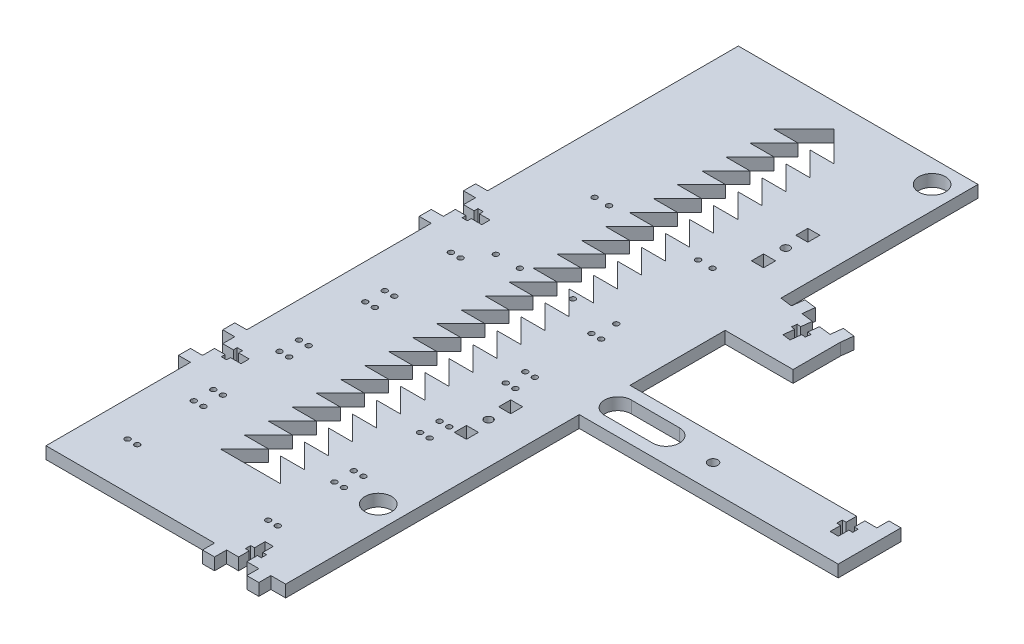
from build123d import *

# Parameters (mm, degrees)
AXLE_SUPPORT_PLATE_R   = 7.030128061
AXLE_SUPPORT_PLATE_W   = 6.35
AXLE_SUPPORT_PLATE_H   = 6.35
AXLE_SUPPORT_PLATE_R_2 = 2.159
AXLE_SUPPORT_PLATE_R_3 = 2.54
BOSS_EXTRUDE1_DEPTH    = 6.35
BOSS_EXTRUDE2_DEPTH    = 6.35
SKETCH2_R              = 1.397
CUT_EXTRUDE1_DEPTH     = 6.35


with BuildPart() as part:
    # Axle Support Plate → Boss-Extrude1 (new body)
    with BuildSketch(Plane(origin=(0, 0, 0), x_dir=(1, 0, 0), z_dir=(0, 1, 0))):
        Polygon((55.41293597, -182.58506403), (63.20506403, -182.58506403), (63.20506403, -102.239078956), (63.20506403, -27.735320151), (199.775192091, -27.735320151), (199.775192091, -0.97506403), (199.775192091, 5.37493597), (193.425192091, 5.37493597), (193.425192091, -0.97506403), (187.075192091, -0.97506403), (187.075192091, -6.510064009), (189.116192073, -6.510064009), (189.116192073, -9.410064051), (187.075192091, -9.410064051), (187.075192091, -14.94506403), (182.757192091, -14.94506403), (182.757192091, -9.410064051), (180.716192109, -9.410064051), (180.716192109, -6.510064009), (182.757192091, -6.510064009), (182.757192091, -0.97506403), (63.20506403, -0.97506403), (63.20506403, 182.58506403), (-63.20506403, 182.58506403), (-63.20506403, 50.33293597), (-69.55506403, 50.33293597), (-69.55506403, 43.98293597), (-63.20506403, 43.98293597), (-63.20506403, 37.63293597), (-57.61706403, 37.63293597), (-57.61706403, 39.673935952), (-54.82306403, 39.673935952), (-54.82306403, 37.63293597), (-49.23506403, 37.63293597), (-49.23506403, 33.31493597), (-54.82306403, 33.31493597), (-54.82306403, 31.273935988), (-57.61706403, 31.273935988), (-57.61706403, 33.31493597), (-63.20506403, 33.31493597), (-63.20506403, 26.96493597), (-69.55506403, 26.96493597), (-69.55506403, 20.61493597), (-63.20506403, 20.61493597), (-63.20506403, -76.66706403), (-69.55506403, -76.66706403), (-69.55506403, -83.01706403), (-63.20506403, -83.01706403), (-63.20506403, -89.36706403), (-57.61706403, -89.36706403), (-57.61706403, -87.326064048), (-54.82306403, -87.326064048), (-54.82306403, -89.36706403), (-49.23506403, -89.36706403), (-49.23506403, -93.68506403), (-54.82306403, -93.68506403), (-54.82306403, -95.726064012), (-57.61706403, -95.726064012), (-57.61706403, -93.68506403), (-63.20506403, -93.68506403), (-63.20506403, -100.03506403), (-69.55506403, -100.03506403), (-69.55506403, -106.38506403), (-63.20506403, -106.38506403), (-63.20506403, -182.58506403), (25.69493597, -182.58506403), (25.69493597, -188.93506403), (32.04493597, -188.93506403), (32.04493597, -182.58506403), (38.39493597, -182.58506403), (38.39493597, -176.99706403), (36.353935988, -176.99706403), (36.353935988, -174.20306403), (38.39493597, -174.20306403), (38.39493597, -168.61506403), (42.71293597, -168.61506403), (42.71293597, -174.20306403), (44.753935952, -174.20306403), (44.753935952, -176.99706403), (42.71293597, -176.99706403), (42.71293597, -182.58506403), (49.06293597, -182.58506403), (49.06293597, -188.93506403), (55.41293597, -188.93506403), align=None)
        with Locations((51.09493597, -121.62506403)):
            Circle(AXLE_SUPPORT_PLATE_R, mode=Mode.SUBTRACT)
        with Locations((41.56993597, -65.61806403)):
            Rectangle(AXLE_SUPPORT_PLATE_W, AXLE_SUPPORT_PLATE_H, mode=Mode.SUBTRACT)
        with Locations((41.56993597, -53.93406403)):
            Circle(AXLE_SUPPORT_PLATE_R_2, mode=Mode.SUBTRACT)
        with Locations((41.56993597, -42.25006403)):
            Rectangle(AXLE_SUPPORT_PLATE_W, AXLE_SUPPORT_PLATE_H, mode=Mode.SUBTRACT)
        with BuildLine():
            ThreePointArc((70.235192091, -21.385320151), (63.20506403, -14.355192091), (70.235192091, -7.32506403))
            Line((70.235192091, -7.32506403), (95.635192091, -7.32506403))
            ThreePointArc((95.635192091, -7.32506403), (102.665320151, -14.355192091), (95.635192091, -21.385320151))
            Line((95.635192091, -21.385320151), (70.235192091, -21.385320151))
        make_face(mode=Mode.SUBTRACT)
        with Locations((120.400192091, -14.355192091)):
            Circle(AXLE_SUPPORT_PLATE_R_3, mode=Mode.SUBTRACT)
        Polygon((-15.875, 154.01006403), (0, 169.88506403), (15.875, 154.01006403), (3.175, 154.01006403), (15.875, 141.31006403), (3.175, 141.31006403), (15.875, 128.61006403), (3.175, 128.61006403), (15.875, 115.91006403), (3.175, 115.91006403), (15.875, 103.21006403), (3.175, 103.21006403), (15.875, 90.51006403), (3.175, 90.51006403), (15.875, 77.81006403), (3.175, 77.81006403), (15.875, 65.11006403), (3.175, 65.11006403), (15.875, 52.41006403), (3.175, 52.41006403), (15.875, 39.71006403), (3.175, 39.71006403), (15.875, 27.01006403), (3.175, 27.01006403), (15.875, 14.31006403), (3.175, 14.31006403), (15.875, 1.61006403), (3.175, 1.61006403), (15.875, -11.08993597), (3.175, -11.08993597), (15.875, -23.78993597), (3.175, -23.78993597), (15.875, -36.48993597), (3.175, -36.48993597), (15.875, -49.18993597), (3.175, -49.18993597), (15.875, -61.88993597), (3.175, -61.88993597), (15.875, -74.58993597), (3.175, -74.58993597), (15.875, -87.28993597), (3.175, -87.28993597), (15.875, -99.98993597), (3.175, -99.98993597), (15.875, -112.68993597), (3.175, -112.68993597), (15.875, -125.38993597), (3.175, -125.38993597), (15.875, -138.08993597), (-15.875, -138.08993597), (-3.175, -125.38993597), (-15.875, -125.38993597), (-3.175, -112.68993597), (-15.875, -112.68993597), (-3.175, -99.98993597), (-15.875, -99.98993597), (-3.175, -87.28993597), (-15.875, -87.28993597), (-3.175, -74.58993597), (-15.875, -74.58993597), (-3.175, -61.88993597), (-15.875, -61.88993597), (-3.175, -49.18993597), (-15.875, -49.18993597), (-3.175, -36.48993597), (-15.875, -36.48993597), (-3.175, -23.78993597), (-15.875, -23.78993597), (-3.175, -11.08993597), (-15.875, -11.08993597), (-3.175, 1.61006403), (-15.875, 1.61006403), (-7.727151853, 9.757912177), (-6.50875, 10.97631403), (-3.175, 14.31006403), (-15.875, 14.31006403), (-3.175, 27.01006403), (-15.875, 27.01006403), (-3.175, 39.71006403), (-15.875, 39.71006403), (-3.175, 52.41006403), (-15.875, 52.41006403), (-3.175, 65.11006403), (-15.875, 65.11006403), (-3.175, 77.81006403), (-15.875, 77.81006403), (-3.175, 90.51006403), (-15.875, 90.51006403), (-3.175, 103.21006403), (-15.875, 103.21006403), (-3.175, 115.91006403), (-15.875, 115.91006403), (-3.175, 128.61006403), (-15.875, 128.61006403), (-3.175, 141.31006403), (-15.875, 141.31006403), (-3.175, 154.01006403), align=None, mode=Mode.SUBTRACT)
        with Locations((41.56993597, 91.09993597)):
            Rectangle(AXLE_SUPPORT_PLATE_W, AXLE_SUPPORT_PLATE_H, mode=Mode.SUBTRACT)
        with Locations((41.56993597, 102.78393597)):
            Circle(AXLE_SUPPORT_PLATE_R_2, mode=Mode.SUBTRACT)
        with Locations((41.56993597, 114.46793597)):
            Rectangle(AXLE_SUPPORT_PLATE_W, AXLE_SUPPORT_PLATE_H, mode=Mode.SUBTRACT)
        with Locations((51.09493597, 170.47493597)):
            Circle(AXLE_SUPPORT_PLATE_R, mode=Mode.SUBTRACT)
    extrude(amount=BOSS_EXTRUDE1_DEPTH)

    # Sketch1 → Boss-Extrude2 (add)
    with BuildSketch(Plane(origin=(0, 6.35, 0), x_dir=(1, 0, 0), z_dir=(0, 1, 0))):
        Polygon((99.004218628, 49.239073995), (99.004218628, 74.257203072), (99.778088958, 80.559871135), (93.475420895, 81.333741465), (92.701550565, 75.031073402), (86.398882502, 75.804943733), (85.717876611, 70.258595838), (87.743663289, 70.00986051), (87.403160343, 67.236686562), (85.377373665, 67.48542189), (84.696367774, 61.939073995), (80.410553492, 62.465305819), (81.091559383, 68.011653715), (79.065772705, 68.260389042), (79.40627565, 71.03356299), (81.432062328, 70.784827662), (82.113068219, 76.331175558), (75.810400156, 77.105045888), (76.584270487, 83.407713951), (70.281602424, 84.181584282), (69.507732093, 77.878916219), (63.20506403, 78.65278655), (63.20506403, 49.239073995), align=None)
    extrude(amount=-BOSS_EXTRUDE2_DEPTH)

    # Sketch2 → Cut-Extrude1 (cut)
    with BuildSketch(Plane(origin=(0, 6.35, 0), x_dir=(1, 0, 0), z_dir=(0, 1, 0))):
        with Locations((8.655592356, 23.463861108)):
            Circle(SKETCH2_R)
        with Locations((-19.284407644, 23.463861108)):
            Circle(SKETCH2_R)
        with Locations((23.895592356, 74.263861108)):
            Circle(SKETCH2_R)
        with Locations((-24.364407644, 75.533861108)):
            Circle(SKETCH2_R)
        with Locations((-31.984407644, 75.533861108)):
            Circle(SKETCH2_R)
        with Locations((31.515592356, 74.263861108)):
            Circle(SKETCH2_R)
        with Locations((-31.984407644, 23.463861108)):
            Circle(SKETCH2_R)
        with Locations((31.515592356, 23.463861108)):
            Circle(SKETCH2_R)
        with Locations((-39.658320907, -123.108510942)):
            Circle(SKETCH2_R)
        with Locations((34.477929093, -123.108510942)):
            Circle(SKETCH2_R)
        with Locations((29.397929093, -123.108510942)):
            Circle(SKETCH2_R)
        with Locations((-44.738320907, -158.033510942)):
            Circle(SKETCH2_R)
        with Locations((-44.738320907, -123.108510942)):
            Circle(SKETCH2_R)
        with Locations((29.397929093, -158.033510942)):
            Circle(SKETCH2_R)
        with Locations((-39.658320907, -158.033510942)):
            Circle(SKETCH2_R)
        with Locations((34.477929093, -158.033510942)):
            Circle(SKETCH2_R)
        with Locations((-39.658320907, -77.902676515)):
            Circle(SKETCH2_R)
        with Locations((34.477929093, -77.902676515)):
            Circle(SKETCH2_R)
        with Locations((29.397929093, -77.902676515)):
            Circle(SKETCH2_R)
        with Locations((-44.738320907, -112.827676515)):
            Circle(SKETCH2_R)
        with Locations((-44.738320907, -77.902676515)):
            Circle(SKETCH2_R)
        with Locations((29.397929093, -112.827676515)):
            Circle(SKETCH2_R)
        with Locations((-39.658320907, -112.827676515)):
            Circle(SKETCH2_R)
        with Locations((34.477929093, -112.827676515)):
            Circle(SKETCH2_R)
        with Locations((-39.658320907, -32.696842088)):
            Circle(SKETCH2_R)
        with Locations((34.477929093, -32.696842088)):
            Circle(SKETCH2_R)
        with Locations((29.397929093, -32.696842088)):
            Circle(SKETCH2_R)
        with Locations((-44.738320907, -67.621842088)):
            Circle(SKETCH2_R)
        with Locations((-44.738320907, -32.696842088)):
            Circle(SKETCH2_R)
        with Locations((29.397929093, -67.621842088)):
            Circle(SKETCH2_R)
        with Locations((-39.658320907, -67.621842088)):
            Circle(SKETCH2_R)
        with Locations((34.477929093, -67.621842088)):
            Circle(SKETCH2_R)
        with Locations((-39.658320907, 12.508992339)):
            Circle(SKETCH2_R)
        with Locations((34.477929093, 12.508992339)):
            Circle(SKETCH2_R)
        with Locations((29.397929093, 12.508992339)):
            Circle(SKETCH2_R)
        with Locations((-44.738320907, -22.416007661)):
            Circle(SKETCH2_R)
        with Locations((-44.738320907, 12.508992339)):
            Circle(SKETCH2_R)
        with Locations((29.397929093, -22.416007661)):
            Circle(SKETCH2_R)
        with Locations((-39.658320907, -22.416007661)):
            Circle(SKETCH2_R)
        with Locations((34.477929093, -22.416007661)):
            Circle(SKETCH2_R)
    extrude(amount=-CUT_EXTRUDE1_DEPTH, mode=Mode.SUBTRACT)


solid = part.part
